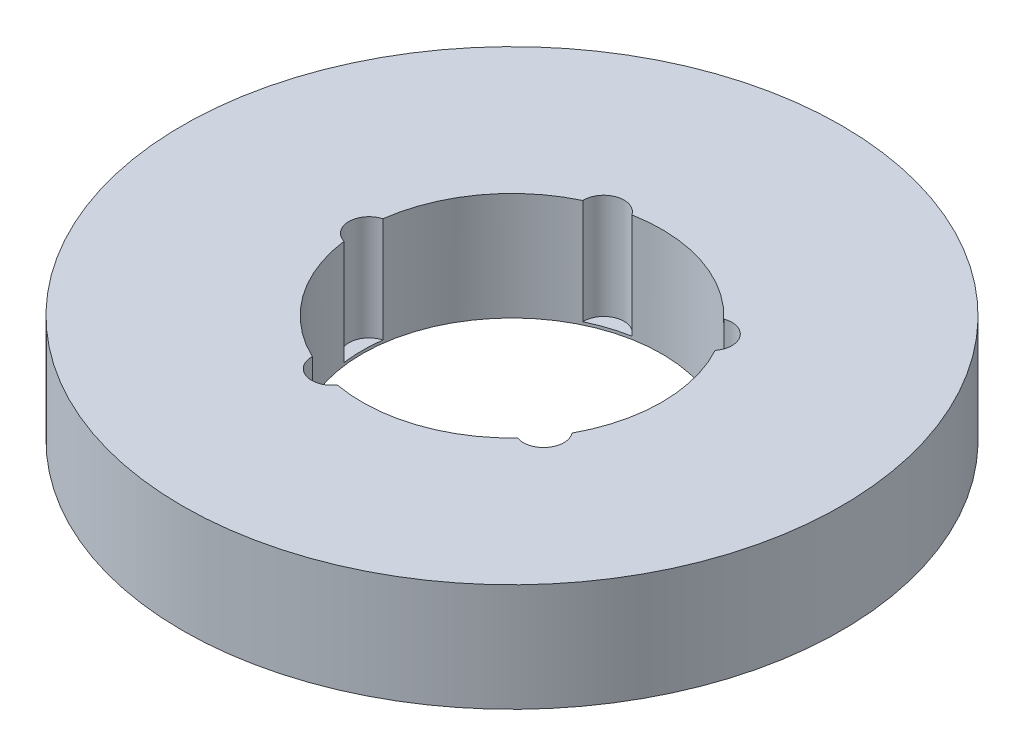
from build123d import *

# Parameters (mm, degrees)
SKETCH1_R           = 82.5
BOSS_EXTRUDE1_DEPTH = 27
SKETCH2_R           = 37.5
CUT_EXTRUDE1_DEPTH  = 120.756001937
SKETCH3_R           = 5.069444641
CUT_EXTRUDE2_DEPTH  = 26.285792784
CIRPATTERN1_COUNT   = 5


with BuildPart() as part:
    # Sketch1 → Boss-Extrude1 (new body)
    with BuildSketch(Plane(origin=(0, 0, 0), x_dir=(1, 0, 0), z_dir=(0, 1, 0))):
        Circle(SKETCH1_R)
    extrude(amount=BOSS_EXTRUDE1_DEPTH)

    # Sketch2 → Cut-Extrude1 (cut, through all)
    with BuildSketch(Plane(origin=(0, 0, 0), x_dir=(1, 0, 0), z_dir=(0, 1, 0))):
        Circle(SKETCH2_R)
    extrude(amount=CUT_EXTRUDE1_DEPTH, mode=Mode.SUBTRACT)

    # Sketch3 → Cut-Extrude2 (cut)
    with BuildSketch(Plane(origin=(0, 27, 0), x_dir=(1, 0, 0), z_dir=(0, 1, 0))):
        with Locations((-35.784654326, 0)):
            Circle(SKETCH3_R)
    cut_extrude2 = extrude(amount=-CUT_EXTRUDE2_DEPTH, mode=Mode.SUBTRACT)

    # CirPattern1: Cut-Extrude2 ×5 about axis
    cirpattern1_axis = Axis((0, 0, 0), (0, 1, 0))
    for i in range(1, CIRPATTERN1_COUNT):
        add(cut_extrude2.rotate(cirpattern1_axis, i * 360 / CIRPATTERN1_COUNT), mode=Mode.SUBTRACT)


solid = part.part
